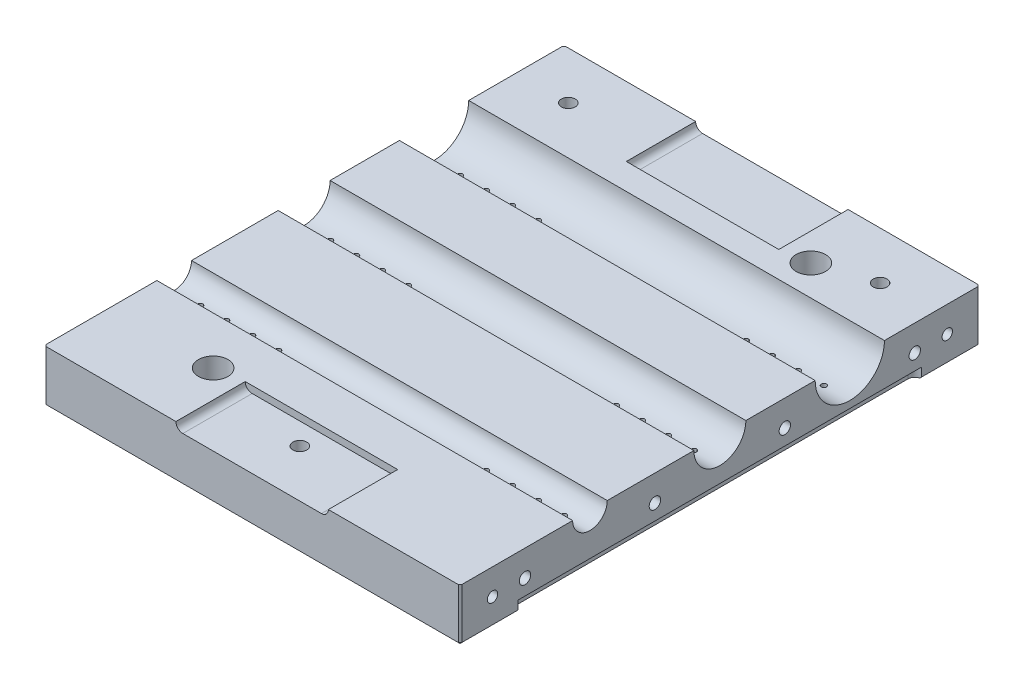
from build123d import *

# Parameters (mm, degrees)
SKETCH1_W                      = 120
SKETCH1_H                      = 150
BOSS_EXTRUDE1_DEPTH            = 15
SKETCH2_R                      = 5
SKETCH2_R_2                    = 7.5
SKETCH2_R_3                    = 10
CUT_EXTRUDE1_DEPTH             = 169.704986624
SKETCH9_W                      = 40
SKETCH9_H                      = 20
CUT_EXTRUDE2_DEPTH             = 2
F_1_5MM_DOWEL_HOLE1_AT_2_COUNT = 2
F_1_5MM_DOWEL_HOLE1_AT_2_PITCH = 7.5
F_1_5MM_DOWEL_HOLE1_AT_3_COUNT = 2
F_1_5MM_DOWEL_HOLE1_AT_3_PITCH = 15
F_1_5MM_DOWEL_HOLE1_AT_4_COUNT = 2
F_1_5MM_DOWEL_HOLE1_AT_4_PITCH = 22.5
F_1_5MM_DOWEL_HOLE1_AT_5_COUNT = 2
F_1_5MM_DOWEL_HOLE1_AT_5_PITCH = 37.5
F_1_5MM_DOWEL_HOLE1_AT_6_COUNT = 2
F_1_5MM_DOWEL_HOLE1_AT_6_PITCH = 38.242646352
F_1_5MM_DOWEL_HOLE1_AT_7_COUNT = 2
F_1_5MM_DOWEL_HOLE1_AT_7_PITCH = 40.388736054
F_1_5MM_DOWEL_HOLE1_AT_8_COUNT = 2
F_1_5MM_DOWEL_HOLE1_AT_8_PITCH = 43.732139211
SKETCH20_W                     = 2
SKETCH20_H                     = 112.5
CUT_EXTRUDE3_DEPTH             = 3
CHAMFER1_SIZE                  = 0.5
CUT_EXTRUDE4_DEPTH             = 20
MIRROR13_COPY_1_DEPTH          = 20
CUT_EXTRUDE5_DEPTH             = 3
MIRROR15_COPY_1_DEPTH          = 3
M10_TAPPED_HOLE2_D             = 8.5
M10_TAPPED_HOLE2_DEPTH         = 24.5
M10_TAPPED_HOLE2_TIP           = 2.553657631
F_4_0MM_DOWEL_HOLE1_D          = 4
F_4_0MM_DOWEL_HOLE1_DEPTH      = 25
F_4_0MM_DOWEL_HOLE1_TIP        = 1.201721238


with BuildPart() as part:
    # Sketch1 → Boss-Extrude1 (new body)
    with BuildSketch(Plane(origin=(0, 0, 0), x_dir=(1, 0, 0), z_dir=(0, 1, 0))):
        with Locations((15.472658693, -42.628111061)):
            Rectangle(SKETCH1_W, SKETCH1_H)
    extrude(amount=BOSS_EXTRUDE1_DEPTH)

    # Sketch2 → Cut-Extrude1 (cut, through all)
    with BuildSketch(Plane(origin=(75.472658693, 0, 0), x_dir=(0, 0, -1), z_dir=(1, 0, 0))):
        with Locations((-80.128111061, 15)):
            Circle(SKETCH2_R)
        with Locations((-42.628111061, 15)):
            Circle(SKETCH2_R_2)
        with Locations((-5.128111061, 15)):
            Circle(SKETCH2_R_3)
    extrude(amount=-CUT_EXTRUDE1_DEPTH, mode=Mode.SUBTRACT)

    # Sketch9 → Cut-Extrude2 (cut)
    with BuildSketch(Plane(origin=(0, 15, 0), x_dir=(1, 0, 0), z_dir=(0, 1, 0))):
        with Locations((15.472658693, -107.628111061)):
            Rectangle(SKETCH9_W, SKETCH9_H)
    cut_extrude2 = extrude(amount=-CUT_EXTRUDE2_DEPTH, mode=Mode.SUBTRACT)

    # Mirror2: Cut-Extrude2 across plane
    add(cut_extrude2.mirror(Plane.XY.offset(42.628111061)), mode=Mode.SUBTRACT)

    # Sketch12 → M4 Tapped Hole2 (revolve, cut)
    with BuildSketch(Plane(origin=(75.472658693, 7.5, 61.378111061), x_dir=(0, 0, -1), z_dir=(0, 1, 0))):
        Polygon((0, 0), (0, 20.991420021), (1.65, 20), (1.65, 0), align=None)
    m4_tapped_hole2 = revolve(axis=Axis((81.822658693, 7.5, 61.378111061), (-1, 0, 0)), mode=Mode.SUBTRACT)

    # Mirror3: M4 Tapped Hole2 across plane
    add(m4_tapped_hole2.mirror(Plane.XY.offset(42.628111061)), mode=Mode.SUBTRACT)

    # Mirror4 copy 1 sketch → Mirror4 copy 1 (revolve, cut)
    with BuildSketch(Plane(origin=(-44.527341307, 7.5, 23.878111061), x_dir=(0, 0, 1), z_dir=(0, 1, 0))):
        Polygon((0, 0), (0, 20.991420021), (1.65, 20), (1.65, 0), align=None)
    revolve(axis=Axis((-50.877341307, 7.5, 23.878111061), (1, 0, 0)), mode=Mode.SUBTRACT)

    # Mirror4 copy 2 sketch → Mirror4 copy 2 (revolve, cut)
    with BuildSketch(Plane(origin=(-44.527341307, 7.5, 61.378111061), x_dir=(0, 0, -1), z_dir=(0, 1, 0))):
        Polygon((0, 0), (0, -20.991420021), (1.65, -20), (1.65, 0), align=None)
    revolve(axis=Axis((-50.877341307, 7.5, 61.378111061), (-1, 0, 0)), mode=Mode.SUBTRACT)

    # Sketch15 → M4 Tapped Hole3 (revolve, cut)
    with BuildSketch(Plane(origin=(75.472658693, 7.5, 98.878111061), x_dir=(0, 0, -1), z_dir=(0, 1, 0))):
        Polygon((0, 0), (0, 20.991420021), (1.65, 20), (1.65, 0), align=None)
    m4_tapped_hole3 = revolve(axis=Axis((81.822658693, 7.5, 98.878111061), (-1, 0, 0)), mode=Mode.SUBTRACT)

    # Mirror5: M4 Tapped Hole3 across plane
    add(m4_tapped_hole3.mirror(Plane.XY.offset(42.628111061)), mode=Mode.SUBTRACT)

    # Mirror6 copy 1 sketch → Mirror6 copy 1 (revolve, cut)
    with BuildSketch(Plane(origin=(-44.527341307, 7.5, -13.621888939), x_dir=(0, 0, 1), z_dir=(0, 1, 0))):
        Polygon((0, 0), (0, 20.991420021), (1.65, 20), (1.65, 0), align=None)
    revolve(axis=Axis((-50.877341307, 7.5, -13.621888939), (1, 0, 0)), mode=Mode.SUBTRACT)

    # Mirror6 copy 2 sketch → Mirror6 copy 2 (revolve, cut)
    with BuildSketch(Plane(origin=(-44.527341307, 7.5, 98.878111061), x_dir=(0, 0, -1), z_dir=(0, 1, 0))):
        Polygon((0, 0), (0, -20.991420021), (1.65, -20), (1.65, 0), align=None)
    revolve(axis=Axis((-50.877341307, 7.5, 98.878111061), (-1, 0, 0)), mode=Mode.SUBTRACT)

    # Sketch19 → Ø1.5mm Dowel Hole1 (revolve, cut)
    with BuildSketch(Plane(origin=(67.972658693, 15, 5.128111061), x_dir=(0, 0, 1), z_dir=(1, 0, 0))):
        Polygon((0, 0), (0, 25.450645464), (0.75, 25), (0.75, 0), align=None)
    f_1_5mm_dowel_hole1 = revolve(axis=Axis((67.972658693, 21.35, 5.128111061), (0, -1, 0)), mode=Mode.SUBTRACT)

    # Ø1.5mm Dowel Hole1 at 2: Ø1.5mm Dowel Hole1 ×2
    with Locations(*[(-i * F_1_5MM_DOWEL_HOLE1_AT_2_PITCH, 0, 0) for i in range(1, F_1_5MM_DOWEL_HOLE1_AT_2_COUNT)]):
        add(f_1_5mm_dowel_hole1, mode=Mode.SUBTRACT)

    # Ø1.5mm Dowel Hole1 at 3: Ø1.5mm Dowel Hole1 ×2
    with Locations(*[(-i * F_1_5MM_DOWEL_HOLE1_AT_3_PITCH, 0, 0) for i in range(1, F_1_5MM_DOWEL_HOLE1_AT_3_COUNT)]):
        add(f_1_5mm_dowel_hole1, mode=Mode.SUBTRACT)

    # Ø1.5mm Dowel Hole1 at 4: Ø1.5mm Dowel Hole1 ×2
    with Locations(*[(-i * F_1_5MM_DOWEL_HOLE1_AT_4_PITCH, 0, 0) for i in range(1, F_1_5MM_DOWEL_HOLE1_AT_4_COUNT)]):
        add(f_1_5mm_dowel_hole1, mode=Mode.SUBTRACT)

    # Ø1.5mm Dowel Hole1 at 5: Ø1.5mm Dowel Hole1 ×2
    with Locations(*[(0, 0, i * F_1_5MM_DOWEL_HOLE1_AT_5_PITCH) for i in range(1, F_1_5MM_DOWEL_HOLE1_AT_5_COUNT)]):
        add(f_1_5mm_dowel_hole1, mode=Mode.SUBTRACT)

    # Ø1.5mm Dowel Hole1 at 6: Ø1.5mm Dowel Hole1 ×2
    with Locations(*[Vector(-0.1961161351381842, 0, 0.9805806756909201) * (i * F_1_5MM_DOWEL_HOLE1_AT_6_PITCH) for i in range(1, F_1_5MM_DOWEL_HOLE1_AT_6_COUNT)]):
        add(f_1_5mm_dowel_hole1, mode=Mode.SUBTRACT)

    # Ø1.5mm Dowel Hole1 at 7: Ø1.5mm Dowel Hole1 ×2
    with Locations(*[Vector(-0.3713906763541039, 0, 0.9284766908852593) * (i * F_1_5MM_DOWEL_HOLE1_AT_7_PITCH) for i in range(1, F_1_5MM_DOWEL_HOLE1_AT_7_COUNT)]):
        add(f_1_5mm_dowel_hole1, mode=Mode.SUBTRACT)

    # Ø1.5mm Dowel Hole1 at 8: Ø1.5mm Dowel Hole1 ×2
    with Locations(*[Vector(-0.5144957554275267, 0, 0.8574929257125441) * (i * F_1_5MM_DOWEL_HOLE1_AT_8_PITCH) for i in range(1, F_1_5MM_DOWEL_HOLE1_AT_8_COUNT)]):
        add(f_1_5mm_dowel_hole1, mode=Mode.SUBTRACT)

    # Mirror7: Ø1.5mm Dowel Hole1 across plane
    add(f_1_5mm_dowel_hole1.mirror(Plane.XY.offset(42.628111061)), mode=Mode.SUBTRACT)

    # Mirror7 copy 1 sketch → Mirror7 copy 1 (revolve, cut)
    with BuildSketch(Plane(origin=(60.472658693, 15, 80.128111061), x_dir=(0, 0, -1), z_dir=(1, 0, 0))):
        Polygon((0, 0), (0, -25.450645464), (0.75, -25), (0.75, 0), align=None)
    revolve(axis=Axis((60.472658693, 21.35, 80.128111061), (0, 1, 0)), mode=Mode.SUBTRACT)

    # Mirror7 copy 2 sketch → Mirror7 copy 2 (revolve, cut)
    with BuildSketch(Plane(origin=(52.972658693, 15, 80.128111061), x_dir=(0, 0, -1), z_dir=(1, 0, 0))):
        Polygon((0, 0), (0, -25.450645464), (0.75, -25), (0.75, 0), align=None)
    revolve(axis=Axis((52.972658693, 21.35, 80.128111061), (0, 1, 0)), mode=Mode.SUBTRACT)

    # Mirror7 copy 3 sketch → Mirror7 copy 3 (revolve, cut)
    with BuildSketch(Plane(origin=(45.472658693, 15, 80.128111061), x_dir=(0, 0, -1), z_dir=(1, 0, 0))):
        Polygon((0, 0), (0, -25.450645464), (0.75, -25), (0.75, 0), align=None)
    revolve(axis=Axis((45.472658693, 21.35, 80.128111061), (0, 1, 0)), mode=Mode.SUBTRACT)

    # Mirror7 copy 4 sketch → Mirror7 copy 4 (revolve, cut)
    with BuildSketch(Plane(origin=(67.972658693, 15, 42.628111061), x_dir=(0, 0, -1), z_dir=(1, 0, 0))):
        Polygon((0, 0), (0, -25.450645464), (0.75, -25), (0.75, 0), align=None)
    revolve(axis=Axis((67.972658693, 21.35, 42.628111061), (0, 1, 0)), mode=Mode.SUBTRACT)

    # Mirror7 copy 5 sketch → Mirror7 copy 5 (revolve, cut)
    with BuildSketch(Plane(origin=(60.472658693, 15, 42.628111061), x_dir=(0, 0, -1), z_dir=(1, 0, 0))):
        Polygon((0, 0), (0, -25.450645464), (0.75, -25), (0.75, 0), align=None)
    revolve(axis=Axis((60.472658693, 21.35, 42.628111061), (0, 1, 0)), mode=Mode.SUBTRACT)

    # Mirror7 copy 6 sketch → Mirror7 copy 6 (revolve, cut)
    with BuildSketch(Plane(origin=(52.972658693, 15, 42.628111061), x_dir=(0, 0, -1), z_dir=(1, 0, 0))):
        Polygon((0, 0), (0, -25.450645464), (0.75, -25), (0.75, 0), align=None)
    revolve(axis=Axis((52.972658693, 21.35, 42.628111061), (0, 1, 0)), mode=Mode.SUBTRACT)

    # Mirror7 copy 7 sketch → Mirror7 copy 7 (revolve, cut)
    with BuildSketch(Plane(origin=(45.472658693, 15, 42.628111061), x_dir=(0, 0, -1), z_dir=(1, 0, 0))):
        Polygon((0, 0), (0, -25.450645464), (0.75, -25), (0.75, 0), align=None)
    revolve(axis=Axis((45.472658693, 21.35, 42.628111061), (0, 1, 0)), mode=Mode.SUBTRACT)

    # Mirror8 copy 1 sketch → Mirror8 copy 1 (revolve, cut)
    with BuildSketch(Plane(origin=(-37.027341307, 15, 80.128111061), x_dir=(0, 0, -1), z_dir=(-1, 0, 0))):
        Polygon((0, 0), (0, 25.450645464), (0.75, 25), (0.75, 0), align=None)
    revolve(axis=Axis((-37.027341307, 21.35, 80.128111061), (0, -1, 0)), mode=Mode.SUBTRACT)

    # Mirror8 copy 2 sketch → Mirror8 copy 2 (revolve, cut)
    with BuildSketch(Plane(origin=(-29.527341307, 15, 80.128111061), x_dir=(0, 0, -1), z_dir=(-1, 0, 0))):
        Polygon((0, 0), (0, 25.450645464), (0.75, 25), (0.75, 0), align=None)
    revolve(axis=Axis((-29.527341307, 21.35, 80.128111061), (0, -1, 0)), mode=Mode.SUBTRACT)

    # Mirror8 copy 3 sketch → Mirror8 copy 3 (revolve, cut)
    with BuildSketch(Plane(origin=(-22.027341307, 15, 80.128111061), x_dir=(0, 0, -1), z_dir=(-1, 0, 0))):
        Polygon((0, 0), (0, 25.450645464), (0.75, 25), (0.75, 0), align=None)
    revolve(axis=Axis((-22.027341307, 21.35, 80.128111061), (0, -1, 0)), mode=Mode.SUBTRACT)

    # Mirror8 copy 4 sketch → Mirror8 copy 4 (revolve, cut)
    with BuildSketch(Plane(origin=(-14.527341307, 15, 80.128111061), x_dir=(0, 0, -1), z_dir=(-1, 0, 0))):
        Polygon((0, 0), (0, 25.450645464), (0.75, 25), (0.75, 0), align=None)
    revolve(axis=Axis((-14.527341307, 21.35, 80.128111061), (0, -1, 0)), mode=Mode.SUBTRACT)

    # Mirror8 copy 5 sketch → Mirror8 copy 5 (revolve, cut)
    with BuildSketch(Plane(origin=(-37.027341307, 15, 42.628111061), x_dir=(0, 0, -1), z_dir=(-1, 0, 0))):
        Polygon((0, 0), (0, 25.450645464), (0.75, 25), (0.75, 0), align=None)
    revolve(axis=Axis((-37.027341307, 21.35, 42.628111061), (0, -1, 0)), mode=Mode.SUBTRACT)

    # Mirror8 copy 6 sketch → Mirror8 copy 6 (revolve, cut)
    with BuildSketch(Plane(origin=(-29.527341307, 15, 42.628111061), x_dir=(0, 0, -1), z_dir=(-1, 0, 0))):
        Polygon((0, 0), (0, 25.450645464), (0.75, 25), (0.75, 0), align=None)
    revolve(axis=Axis((-29.527341307, 21.35, 42.628111061), (0, -1, 0)), mode=Mode.SUBTRACT)

    # Mirror8 copy 7 sketch → Mirror8 copy 7 (revolve, cut)
    with BuildSketch(Plane(origin=(-22.027341307, 15, 42.628111061), x_dir=(0, 0, -1), z_dir=(-1, 0, 0))):
        Polygon((0, 0), (0, 25.450645464), (0.75, 25), (0.75, 0), align=None)
    revolve(axis=Axis((-22.027341307, 21.35, 42.628111061), (0, -1, 0)), mode=Mode.SUBTRACT)

    # Mirror8 copy 8 sketch → Mirror8 copy 8 (revolve, cut)
    with BuildSketch(Plane(origin=(-14.527341307, 15, 42.628111061), x_dir=(0, 0, -1), z_dir=(-1, 0, 0))):
        Polygon((0, 0), (0, 25.450645464), (0.75, 25), (0.75, 0), align=None)
    revolve(axis=Axis((-14.527341307, 21.35, 42.628111061), (0, -1, 0)), mode=Mode.SUBTRACT)

    # Mirror8 copy 9 sketch → Mirror8 copy 9 (revolve, cut)
    with BuildSketch(Plane(origin=(-37.027341307, 15, 5.128111061), x_dir=(0, 0, 1), z_dir=(-1, 0, 0))):
        Polygon((0, 0), (0, -25.450645464), (0.75, -25), (0.75, 0), align=None)
    revolve(axis=Axis((-37.027341307, 21.35, 5.128111061), (0, 1, 0)), mode=Mode.SUBTRACT)

    # Mirror8 copy 10 sketch → Mirror8 copy 10 (revolve, cut)
    with BuildSketch(Plane(origin=(-29.527341307, 15, 5.128111061), x_dir=(0, 0, 1), z_dir=(-1, 0, 0))):
        Polygon((0, 0), (0, -25.450645464), (0.75, -25), (0.75, 0), align=None)
    revolve(axis=Axis((-29.527341307, 21.35, 5.128111061), (0, 1, 0)), mode=Mode.SUBTRACT)

    # Mirror8 copy 11 sketch → Mirror8 copy 11 (revolve, cut)
    with BuildSketch(Plane(origin=(-22.027341307, 15, 5.128111061), x_dir=(0, 0, 1), z_dir=(-1, 0, 0))):
        Polygon((0, 0), (0, -25.450645464), (0.75, -25), (0.75, 0), align=None)
    revolve(axis=Axis((-22.027341307, 21.35, 5.128111061), (0, 1, 0)), mode=Mode.SUBTRACT)

    # Mirror8 copy 12 sketch → Mirror8 copy 12 (revolve, cut)
    with BuildSketch(Plane(origin=(-14.527341307, 15, 5.128111061), x_dir=(0, 0, 1), z_dir=(-1, 0, 0))):
        Polygon((0, 0), (0, -25.450645464), (0.75, -25), (0.75, 0), align=None)
    revolve(axis=Axis((-14.527341307, 21.35, 5.128111061), (0, 1, 0)), mode=Mode.SUBTRACT)

    # Mirror8 copy 13 sketch → Mirror8 copy 13 (revolve, cut)
    with BuildSketch(Plane(origin=(-37.027341307, 15, 42.628111061), x_dir=(0, 0, 1), z_dir=(-1, 0, 0))):
        Polygon((0, 0), (0, -25.450645464), (0.75, -25), (0.75, 0), align=None)
    revolve(axis=Axis((-37.027341307, 21.35, 42.628111061), (0, 1, 0)), mode=Mode.SUBTRACT)

    # Mirror8 copy 14 sketch → Mirror8 copy 14 (revolve, cut)
    with BuildSketch(Plane(origin=(-29.527341307, 15, 42.628111061), x_dir=(0, 0, 1), z_dir=(-1, 0, 0))):
        Polygon((0, 0), (0, -25.450645464), (0.75, -25), (0.75, 0), align=None)
    revolve(axis=Axis((-29.527341307, 21.35, 42.628111061), (0, 1, 0)), mode=Mode.SUBTRACT)

    # Mirror8 copy 15 sketch → Mirror8 copy 15 (revolve, cut)
    with BuildSketch(Plane(origin=(-22.027341307, 15, 42.628111061), x_dir=(0, 0, 1), z_dir=(-1, 0, 0))):
        Polygon((0, 0), (0, -25.450645464), (0.75, -25), (0.75, 0), align=None)
    revolve(axis=Axis((-22.027341307, 21.35, 42.628111061), (0, 1, 0)), mode=Mode.SUBTRACT)

    # Mirror8 copy 16 sketch → Mirror8 copy 16 (revolve, cut)
    with BuildSketch(Plane(origin=(-14.527341307, 15, 42.628111061), x_dir=(0, 0, 1), z_dir=(-1, 0, 0))):
        Polygon((0, 0), (0, -25.450645464), (0.75, -25), (0.75, 0), align=None)
    revolve(axis=Axis((-14.527341307, 21.35, 42.628111061), (0, 1, 0)), mode=Mode.SUBTRACT)

    # Sketch20 → Cut-Extrude3 (cut)
    with BuildSketch(Plane.XZ):
        with Locations((-43.527341307, 42.628111061)):
            Rectangle(SKETCH20_W, SKETCH20_H)
    cut_extrude3 = extrude(amount=-CUT_EXTRUDE3_DEPTH, mode=Mode.SUBTRACT)

    # Mirror9: Cut-Extrude3 across plane
    add(cut_extrude3.mirror(Plane(origin=(15.472658693, 0, 0), x_dir=(0, 0, 1), z_dir=(1, 0, 0))), mode=Mode.SUBTRACT)

    # Chamfer1
    chamfer1_edges = [part.edges().sort_by_distance(p)[0] for p in [
        (-44.527341307, 0, -22.996888939),
        (-44.527341307, 7.5, -32.371888939),
        (15.472658693, 0, -32.371888939),
        (75.472658693, 7.5, -32.371888939),
        (75.472658693, 0, -22.996888939),
        (75.472658693, 0, 108.253111061),
        (75.472658693, 7.5, 117.628111061),
        (-44.527341307, 7.5, 117.628111061),
        (-44.527341307, 0, 108.253111061),
        (15.472658693, 0, 117.628111061),
    ]]
    chamfer(chamfer1_edges, length=CHAMFER1_SIZE)

    # Sketch23 → Ø3.0mm Dowel Hole1 (revolve, cut)
    with BuildSketch(Plane(origin=(75.472658693, 7.5, 108.253111061), x_dir=(0, 0, -1), z_dir=(0, 1, 0))):
        Polygon((0, 0), (0, 25.901290929), (1.5, 25), (1.5, 0), align=None)
    f_3_0mm_dowel_hole1 = revolve(axis=Axis((81.822658693, 7.5, 108.253111061), (-1, 0, 0)), mode=Mode.SUBTRACT)

    # Mirror10: Ø3.0mm Dowel Hole1 across plane
    add(f_3_0mm_dowel_hole1.mirror(Plane.XY.offset(42.628111061)), mode=Mode.SUBTRACT)

    # Mirror11 copy 1 sketch → Mirror11 copy 1 (revolve, cut)
    with BuildSketch(Plane(origin=(-44.527341307, 7.5, -22.996888939), x_dir=(0, 0, 1), z_dir=(0, 1, 0))):
        Polygon((0, 0), (0, 25.901290929), (1.5, 25), (1.5, 0), align=None)
    revolve(axis=Axis((-50.877341307, 7.5, -22.996888939), (1, 0, 0)), mode=Mode.SUBTRACT)

    # Mirror11 copy 2 sketch → Mirror11 copy 2 (revolve, cut)
    with BuildSketch(Plane(origin=(-44.527341307, 7.5, 108.253111061), x_dir=(0, 0, -1), z_dir=(0, 1, 0))):
        Polygon((0, 0), (0, -25.901290929), (1.5, -25), (1.5, 0), align=None)
    revolve(axis=Axis((-50.877341307, 7.5, 108.253111061), (-1, 0, 0)), mode=Mode.SUBTRACT)

    # Sketch24 → Cut-Extrude4 (cut)
    with BuildSketch(Plane.XY.offset(117.628111061)):
        with BuildLine():
            Line((35.472658693, 13), (35.472658693, 15))
            Line((35.472658693, 15), (37.472658693, 15))
            ThreePointArc((37.472658693, 15), (36.886872255, 13.585786438), (35.472658693, 13))
        make_face()
    cut_extrude4 = extrude(amount=-CUT_EXTRUDE4_DEPTH, mode=Mode.SUBTRACT)

    # Mirror12: Cut-Extrude4 across plane
    add(cut_extrude4.mirror(Plane(origin=(15.472658693, 0, 0), x_dir=(0, 0, 1), z_dir=(1, 0, 0))), mode=Mode.SUBTRACT)

    # Mirror13: Cut-Extrude4 across plane
    add(cut_extrude4.mirror(Plane.XY.offset(42.628111061)), mode=Mode.SUBTRACT)

    # Mirror13 copy 1 sketch → Mirror13 copy 1 (cut)
    with BuildSketch(Plane(origin=(30.945317386, 0, -32.371888939), x_dir=(-1, 0, 0), z_dir=(0, 0, -1))):
        with BuildLine():
            Line((35.472658693, 13), (35.472658693, 15))
            Line((35.472658693, 15), (37.472658693, 15))
            ThreePointArc((37.472658693, 15), (36.886872255, 13.585786438), (35.472658693, 13))
        make_face()
    extrude(amount=-MIRROR13_COPY_1_DEPTH, mode=Mode.SUBTRACT)

    # Sketch25 → Cut-Extrude5 (cut)
    with BuildSketch(Plane.XZ):
        with BuildLine():
            Line((73.472658693, 98.878111061), (75.472658693, 98.878111061))
            Line((75.472658693, 98.878111061), (75.472658693, 100.878111061))
            ThreePointArc((75.472658693, 100.878111061), (74.058445131, 100.292324624), (73.472658693, 98.878111061))
        make_face()
    cut_extrude5 = extrude(amount=-CUT_EXTRUDE5_DEPTH, mode=Mode.SUBTRACT)

    # Mirror14: Cut-Extrude5 across plane
    add(cut_extrude5.mirror(Plane.XY.offset(42.628111061)), mode=Mode.SUBTRACT)

    # Mirror15: Cut-Extrude5 across plane
    add(cut_extrude5.mirror(Plane(origin=(15.472658693, 0, 0), x_dir=(0, 0, 1), z_dir=(1, 0, 0))), mode=Mode.SUBTRACT)

    # Mirror15 copy 1 sketch → Mirror15 copy 1 (cut)
    with BuildSketch(Plane(origin=(30.945317386, 0, 85.256222122), x_dir=(-1, 0, 0), z_dir=(0, -1, 0))):
        with BuildLine():
            Line((73.472658693, 98.878111061), (75.472658693, 98.878111061))
            Line((75.472658693, 98.878111061), (75.472658693, 100.878111061))
            ThreePointArc((75.472658693, 100.878111061), (74.058445131, 100.292324624), (73.472658693, 98.878111061))
        make_face()
    extrude(amount=-MIRROR15_COPY_1_DEPTH, mode=Mode.SUBTRACT)

    # M10 Tapped Hole2
    with Locations(Plane(origin=(45.472658693, 0, -13.621888939), x_dir=(0, 0, -1), z_dir=(0, -1, 0))):
        with Locations((0, 0), (-112.5, -60)):
            Hole(M10_TAPPED_HOLE2_D / 2, depth=M10_TAPPED_HOLE2_DEPTH)
            with Locations((0, 0, -(M10_TAPPED_HOLE2_DEPTH + M10_TAPPED_HOLE2_TIP / 2))):  # 118° drill point
                Cone(0, M10_TAPPED_HOLE2_D / 2, M10_TAPPED_HOLE2_TIP, mode=Mode.SUBTRACT)

    # Ø4.0mm Dowel Hole1
    with Locations(Plane(origin=(60.472658693, 15, -18.621888939), x_dir=(0, 0, 1), z_dir=(0, 1, 0))):
        with Locations((0, 0), (0, -90), (122.5, -45)):
            Hole(F_4_0MM_DOWEL_HOLE1_D / 2, depth=F_4_0MM_DOWEL_HOLE1_DEPTH)
            with Locations((0, 0, -(F_4_0MM_DOWEL_HOLE1_DEPTH + F_4_0MM_DOWEL_HOLE1_TIP / 2))):  # 118° drill point
                Cone(0, F_4_0MM_DOWEL_HOLE1_D / 2, F_4_0MM_DOWEL_HOLE1_TIP, mode=Mode.SUBTRACT)


solid = part.part
